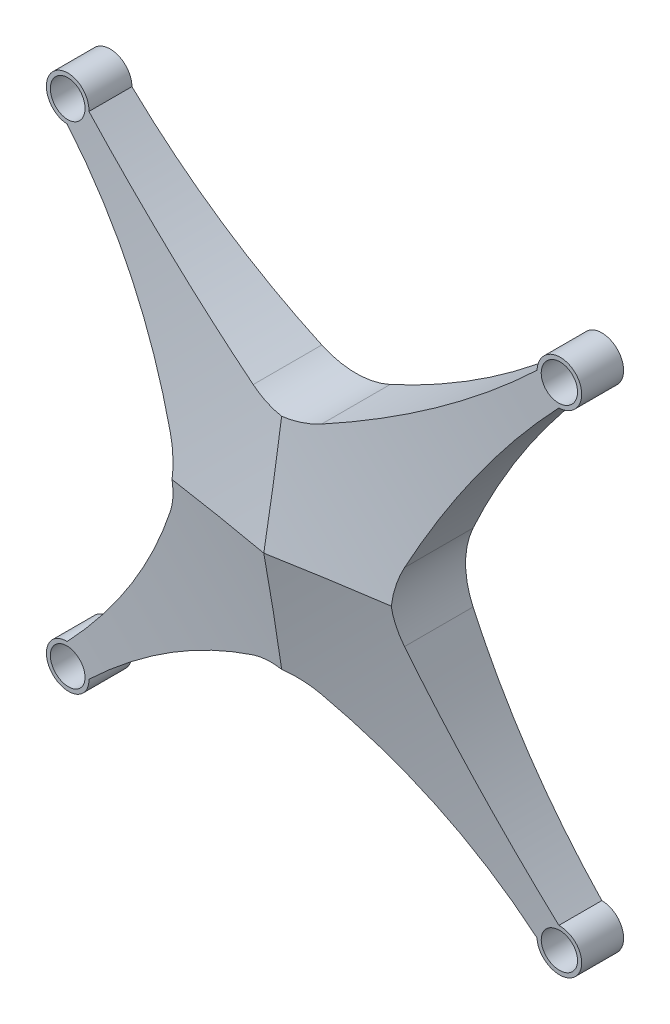
from build123d import *

# Parameters (mm, degrees)
SKETCH2_R           = 11
BOSS_EXTRUDE1_DEPTH = 57.15
CUT_EXTRUDE3_DEPTH  = 242.478244523
CIRPATTERN8_COUNT   = 4
FILLET2_R           = 50.8
SHELL2_T            = -2.54


with BuildPart() as part:
    # Sketch2 → Boss-Extrude1 (new body)
    with BuildSketch(Plane.XY):
        with BuildLine():
            Line((-63.5, 0), (0, 0))
            Line((0, 0), (0, -63.5))
            add(Edge.make_bspline(
                [(-138.9, -152.4), (-78.007237143, -94.534263717), (0, -63.5)],
                knots=[0, 0, 0, 1, 1, 1], degree=2))
            ThreePointArc((-138.9, -152.4), (-161.945941546, -161.945941546), (-152.4, -138.9))
            add(Edge.make_bspline(
                [(-152.4, -138.9), (-94.534263717, -78.007237143), (-63.5, 0)],
                knots=[0, 0, 0, 1, 1, 1], degree=2))
        make_face()
        with Locations((-152.4, -152.4)):
            Circle(SKETCH2_R, mode=Mode.SUBTRACT)
    boss_extrude1 = extrude(amount=BOSS_EXTRUDE1_DEPTH)

    # Sketch8 → Cut-Extrude3 (cut, symmetric)
    with BuildSketch(Plane(origin=(0, 0, 0), x_dir=(-0.7071067811865477, -0.7071067811865474, 0), z_dir=(0.7071067811865474, -0.7071067811865477, 0))):
        with BuildLine():
            Line((229.279704742, -25.910187705), (229.279704742, -69.010554545))
            Line((229.279704742, -69.010554545), (0, -69.010554545))
            Line((0, -69.010554545), (0, -57.15))
            add(Edge.make_bspline(
                [(229.279704742, -25.910187705), (112.797912687, -28.221883701), (0, -57.15)],
                knots=[0, 0, 0, 1, 1, 1], degree=2))
        make_face()
    cut_extrude3 = extrude(amount=CUT_EXTRUDE3_DEPTH, both=True, mode=Mode.SUBTRACT)

    # CirPattern8: Boss-Extrude1, Cut-Extrude3 ×4 about axis
    cirpattern8_axis = Axis((0, 0, 57.15), (0, 0, -1))
    add([boss_extrude1.rotate(cirpattern8_axis, i * 360 / CIRPATTERN8_COUNT) for i in range(1, CIRPATTERN8_COUNT)])
    add([cut_extrude3.rotate(cirpattern8_axis, i * 360 / CIRPATTERN8_COUNT) for i in range(1, CIRPATTERN8_COUNT)], mode=Mode.SUBTRACT)

    # Fillet2
    fillet2_edges = [part.edges().sort_by_distance(p)[0] for p in [
        (0, 63.5, 23.359708793),
        (-63.5, 0, 23.359708793),
        (0, -63.5, 23.359708793),
        (63.5, 0, 23.359708793),
    ]]
    fillet(fillet2_edges, radius=FILLET2_R)

    # Shell2
    shell2_openings = [part.faces().sort_by_distance(p)[0] for p in [
        (0, 0, 0),
    ]]
    offset(amount=SHELL2_T, openings=shell2_openings)


solid = part.part
